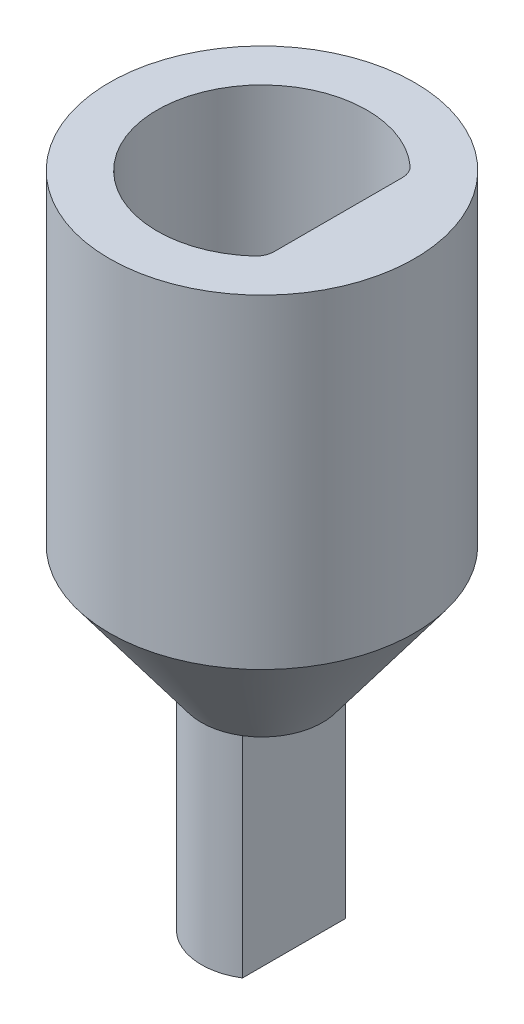
from build123d import *

# Parameters (mm, degrees)
SKETCH1_R               = 8
BOSS_EXTRUDE1_DEPTH     = 12
CUT_EXTRUDE1_DEPTH      = 12
CUT_EXTRUDE1_DEPTH_BACK = 12
SKETCH3_W               = 1.5
SKETCH3_H               = 11
FILLET2_R               = 1
FILLET3_R               = 1


with BuildPart() as part:
    # Sketch1 → Boss-Extrude1 (new body)
    with BuildSketch(Plane(origin=(0, 0, 0), x_dir=(1, 0, 0), z_dir=(0, 1, 0))):
        Circle(SKETCH1_R)
        with BuildLine():
            Line((4, 0.034186786), (4, 3.774917218))
            ThreePointArc((4, 3.774917218), (-5.5, 0), (4, -3.774917218))
            Line((4, -3.774917218), (4, 0.034186786))
        make_face(mode=Mode.SUBTRACT)
    extrude(amount=BOSS_EXTRUDE1_DEPTH)

    # Sketch2 → Revolve1 (revolve)
    with BuildSketch(Plane.XY):
        Polygon((8, 0), (8, -5), (3.175, -11.473666382), (3.175, -22.473666382), (0, -22.473666382), (0, 0), align=None)
    revolve(axis=Axis((0, -22.473666382, 0), (0, -1, 0)))

    # Sketch3 → Cut-Extrude1 (cut, two sides: drawn at the far end of the back side and taken through both)
    with BuildSketch(Plane.XY.offset(-CUT_EXTRUDE1_DEPTH_BACK)):
        with Locations((2.425, -16.973666382)):
            Rectangle(SKETCH3_W, SKETCH3_H)
    extrude(amount=CUT_EXTRUDE1_DEPTH + CUT_EXTRUDE1_DEPTH_BACK, mode=Mode.SUBTRACT)

    # Fillet2
    fillet2_edges = [part.edges().sort_by_distance(p)[0] for p in [
        (4, 6, -3.774917218),
    ]]
    fillet(fillet2_edges, radius=FILLET2_R)

    # Fillet3
    fillet3_edges = [part.edges().sort_by_distance(p)[0] for p in [
        (4, 6, 3.774917218),
    ]]
    fillet(fillet3_edges, radius=FILLET3_R)


solid = part.part
